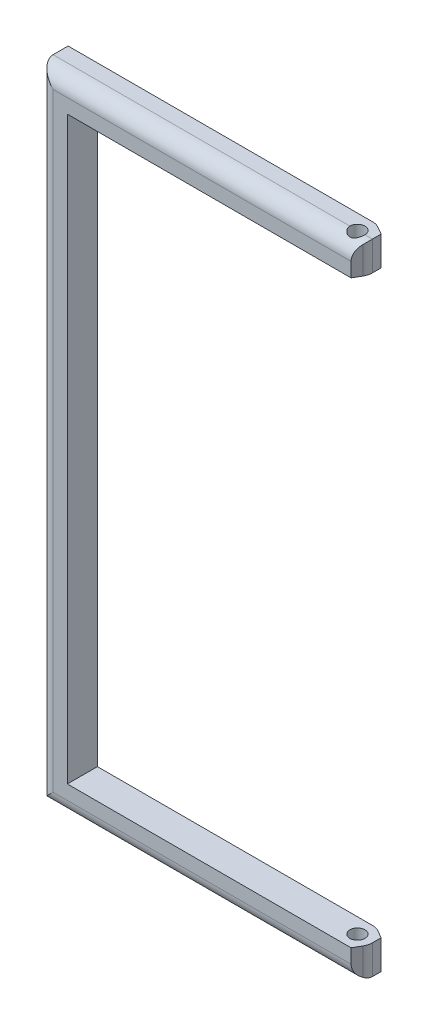
from build123d import *

# Parameters (mm, degrees)
EXTRUDE_1_DEPTH          = 4
CUT_EXTRUDE_1_REACH      = 162.681
SKETCH_2_R               = 1
CUT_EXTRUDE_2_DEPTH      = 161.68143152
CUT_EXTRUDE_2_DEPTH_BACK = 161.68143152
FILLET_1_R               = 2


with BuildPart() as part:
    # 草图1 → 凸台-拉伸1 (new body)
    with BuildSketch(Plane.XY):
        Polygon((136.299385308, -68.941921014), (136.299385308, -65.041921014), (97.699385308, -65.041921014), (97.699385308, 12.158078986), (136.299385308, 12.158078986), (136.299385308, 16.058078986), (93.799385308, 16.058078986), (93.799385308, -68.941921014), align=None)
    extrude(amount=-EXTRUDE_1_DEPTH)

    # 草图2 → 切除-拉伸1 (cut, up to next)
    with BuildSketch(Plane.XZ.offset(68.941921014), mode=Mode.PRIVATE) as cut_extrude_1_sk1:
        with Locations(Location((134.299385308, -2, 0), (0, 0, 270))):
            Circle(SKETCH_2_R)
    cut_extrude_1_tool1 = extrude(cut_extrude_1_sk1.sketch, amount=-CUT_EXTRUDE_1_REACH, mode=Mode.PRIVATE) & part.part
    cut_extrude_1 = cut_extrude_1_tool1.solids().sort_by_distance((134.299385, -68.941921, -2))[0]
    add(cut_extrude_1, mode=Mode.SUBTRACT)

    # 镜向1: 切除-拉伸1 across plane
    add(cut_extrude_1.mirror(Plane(origin=(0, -26.441921014, 0), x_dir=(0, 0, 1), z_dir=(0, -1, 0))), mode=Mode.SUBTRACT)

    # 草图3 → 切除-拉伸2 (cut, two sides: drawn at the far end of the back side and taken through both)
    with BuildSketch(Plane(origin=(0, 16.058078986, 0), x_dir=(1, 0, 0), z_dir=(0, 1, 0)).offset(-CUT_EXTRUDE_2_DEPTH_BACK)):
        with BuildLine():
            Line((136.299385308, 3.154700538), (136.299385308, 4))
            Line((136.299385308, 4), (134.299385308, 4))
            ThreePointArc((134.299385308, 4), (134.817023399, 3.931851653), (135.299385308, 3.732050808))
            Line((135.299385308, 3.732050808), (136.299385308, 3.154700538))
        make_face()
        with BuildLine():
            Line((135.454085847, 0), (136.031436116, 1))
            ThreePointArc((136.031436116, 1), (136.231236961, 1.48236191), (136.299385308, 2))
            Line((136.299385308, 2), (136.299385308, 1.464101615))
            Line((136.299385308, 1.464101615), (136.299385308, 0))
            Line((136.299385308, 0), (135.454085847, 0))
        make_face()
    extrude(amount=CUT_EXTRUDE_2_DEPTH + CUT_EXTRUDE_2_DEPTH_BACK, mode=Mode.SUBTRACT)

    # 圆角1
    # the kernel refuses this fillet: 2 mm, written as the material it takes off along each edge
    with BuildSketch(Plane(origin=(140.454085847, 16.058078986, 0), x_dir=(0, -1, 0), z_dir=(-1, 0, 0))) as fillet_1_piece_1:
        with BuildLine():
            CenterArc((FILLET_1_R, -FILLET_1_R), FILLET_1_R, 90, 90)
            Line((0, -FILLET_1_R), (0, 0))
            Line((0, 0), (FILLET_1_R, 0))
        make_face()
    extrude(amount=51.654700538, mode=Mode.SUBTRACT)
    with BuildSketch(Plane(origin=(93.799385308, 21.058078986, 0), x_dir=(1, 0, 0), z_dir=(0, -1, 0))) as fillet_1_piece_2:
        with BuildLine():
            CenterArc((FILLET_1_R, -FILLET_1_R), FILLET_1_R, 90, 90)
            Line((0, -FILLET_1_R), (0, 0))
            Line((0, 0), (FILLET_1_R, 0))
        make_face()
    extrude(amount=95, mode=Mode.SUBTRACT)
    with BuildSketch(Plane(origin=(88.799385308, -68.941921014, 0), x_dir=(0, 0, -1), z_dir=(1, 0, 0))) as fillet_1_piece_3:
        with BuildLine():
            CenterArc((FILLET_1_R, FILLET_1_R), FILLET_1_R, 180, 90)
            Line((0, FILLET_1_R), (0, 0))
            Line((0, 0), (FILLET_1_R, 0))
        make_face()
    extrude(amount=51.654700538, mode=Mode.SUBTRACT)


solid = part.part
